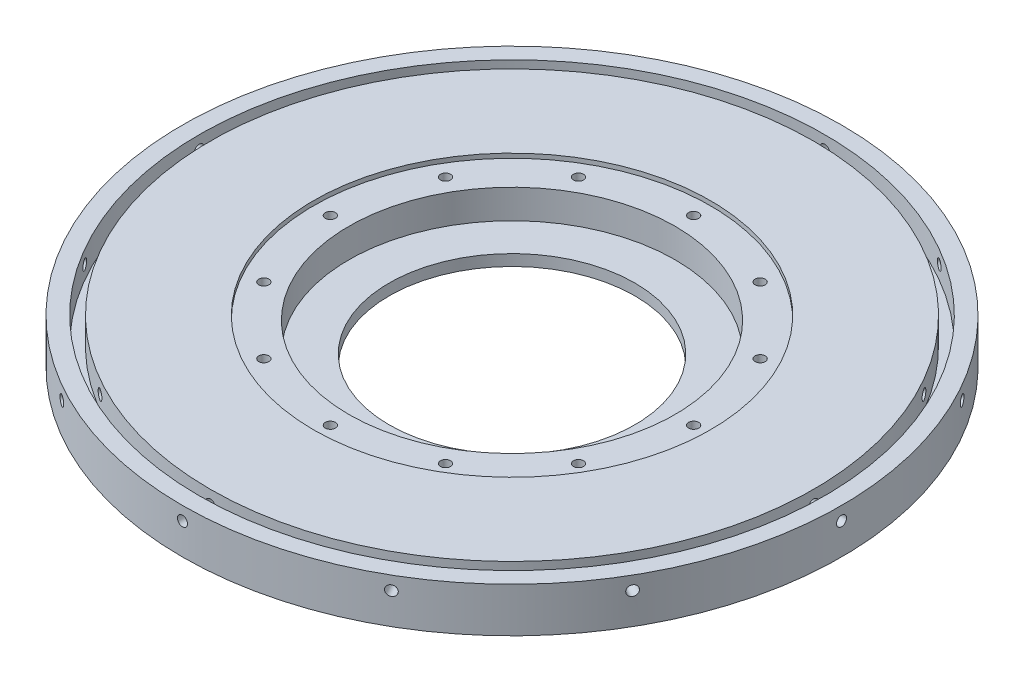
from build123d import *

# Parameters (mm, degrees)
SKETCH1_W           = 127.635
SKETCH1_H           = 127.635
BOSS_EXTRUDE1_DEPTH = 9.525
SKETCH13_R          = 93.6625
BOSS_EXTRUDE2_DEPTH = 12.7
SKETCH5_R           = 46.355
CUT_EXTRUDE1_DEPTH  = 9.525
SKETCH11_R          = 1.4351
CUT_EXTRUDE3_DEPTH  = 224.072165005
CIRPATTERN1_COUNT   = 12
SKETCH12_R          = 56.41975
CUT_EXTRUDE4_DEPTH  = 1.27
SKETCH16_R          = 88.9
SKETCH16_R_2        = 85.725
CUT_EXTRUDE5_DEPTH  = 7.62
SKETCH17_R          = 1.4351
CUT_EXTRUDE6_DEPTH  = 15.24
CIRPATTERN2_COUNT   = 12
SKETCH19_R          = 34.925
CUT_EXTRUDE7_DEPTH  = 87.63


with BuildPart() as part:
    # Sketch1 → Boss-Extrude1 (new body)
    with BuildSketch(Plane(origin=(0, 0, 0), x_dir=(1, 0, 0), z_dir=(0, 1, 0))):
        with Locations((63.8175, 63.8175)):
            Rectangle(SKETCH1_W, SKETCH1_H)
    extrude(amount=BOSS_EXTRUDE1_DEPTH)

    # Sketch13 → Boss-Extrude2 (add)
    with BuildSketch(Plane(origin=(0, 9.525, 0), x_dir=(1, 0, 0), z_dir=(0, 1, 0))):
        with Locations((63.8175, 63.8175)):
            Circle(SKETCH13_R)
    extrude(amount=-BOSS_EXTRUDE2_DEPTH)

    # Sketch5 → Cut-Extrude1 (cut)
    with BuildSketch(Plane(origin=(0, 9.525, 0), x_dir=(1, 0, 0), z_dir=(0, 1, 0))):
        with Locations((63.8175, 63.8175)):
            Circle(SKETCH5_R)
        with Locations((63.8175, 63.8175)):
            Circle(SKETCH5_R)
    extrude(amount=-CUT_EXTRUDE1_DEPTH, mode=Mode.SUBTRACT)

    # Sketch11 → Cut-Extrude3 (cut, through all)
    with BuildSketch(Plane(origin=(0, 9.525, 0), x_dir=(1, 0, 0), z_dir=(0, 1, 0))):
        with Locations((63.8175, 115.443)):
            Circle(SKETCH11_R)
    cut_extrude3 = extrude(amount=-CUT_EXTRUDE3_DEPTH, mode=Mode.SUBTRACT)

    # CirPattern1: Cut-Extrude3 ×12 about axis
    cirpattern1_axis = Axis((63.8175, 9.525, -63.8175), (0, 1, 0))
    for i in range(1, CIRPATTERN1_COUNT):
        add(cut_extrude3.rotate(cirpattern1_axis, i * 360 / CIRPATTERN1_COUNT), mode=Mode.SUBTRACT)

    # Sketch12 → Cut-Extrude4 (cut)
    with BuildSketch(Plane(origin=(0, 9.525, 0), x_dir=(1, 0, 0), z_dir=(0, 1, 0))):
        with Locations((63.8175, 63.8175)):
            Circle(SKETCH12_R)
    extrude(amount=-CUT_EXTRUDE4_DEPTH, mode=Mode.SUBTRACT)

    # Sketch16 → Cut-Extrude5 (cut)
    with BuildSketch(Plane(origin=(0, 9.525, 0), x_dir=(1, 0, 0), z_dir=(0, 1, 0))):
        with Locations((63.8175, 63.8175)):
            Circle(SKETCH16_R)
        with Locations((63.8175, 63.8175)):
            Circle(SKETCH16_R_2, mode=Mode.SUBTRACT)
    extrude(amount=-CUT_EXTRUDE5_DEPTH, mode=Mode.SUBTRACT)

    # Sketch17 → Cut-Extrude6 (cut)
    with BuildSketch(Plane.XY.offset(29.845)):
        with Locations((63.8175, 5.715)):
            Circle(SKETCH17_R)
    cut_extrude6 = extrude(amount=-CUT_EXTRUDE6_DEPTH, mode=Mode.SUBTRACT)

    # CirPattern2: Cut-Extrude6 ×12 about axis
    cirpattern2_axis = Axis((63.8175, -3.175, -63.8175), (0, 1, 0))
    for i in range(1, CIRPATTERN2_COUNT):
        add(cut_extrude6.rotate(cirpattern2_axis, i * 360 / CIRPATTERN2_COUNT), mode=Mode.SUBTRACT)

    # Sketch19 → Cut-Extrude7 (cut)
    with BuildSketch(Plane.XZ.offset(3.175)):
        with Locations((63.8175, -63.8175)):
            Circle(SKETCH19_R)
    extrude(amount=-CUT_EXTRUDE7_DEPTH, mode=Mode.SUBTRACT)


solid = part.part
